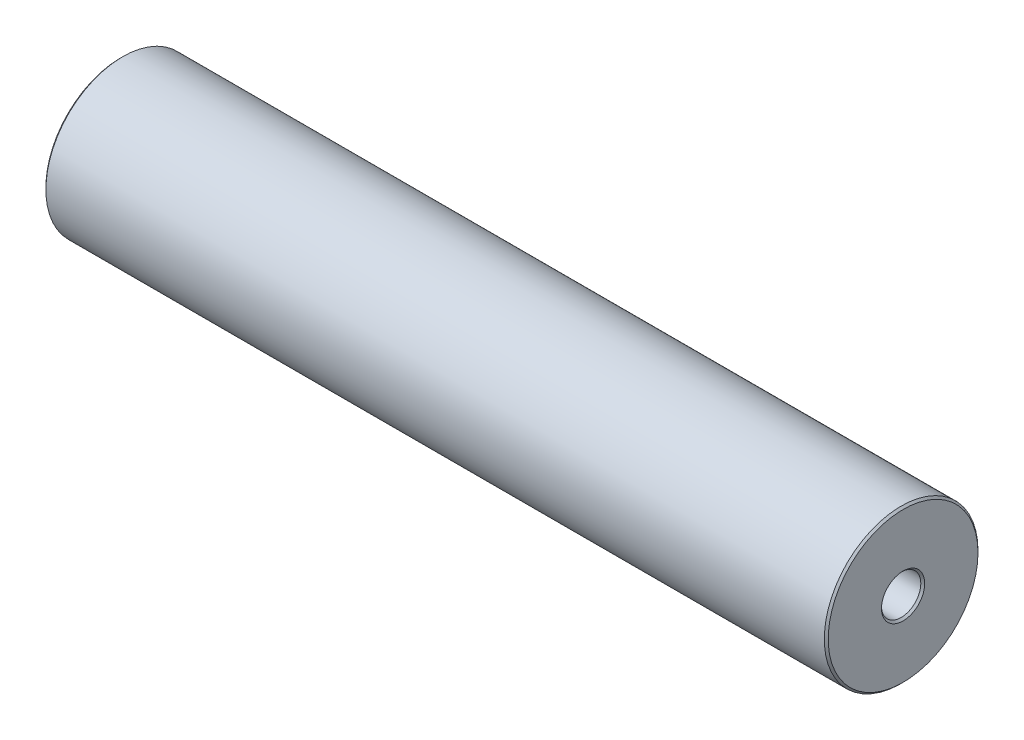
from build123d import *

# Parameters (mm, degrees)
SKETCH2_R                             = 9.980949939
BOSS_EXTRUDE1_DEPTH                   = 50.8
F_1_4_20_TAPPED_HOLE1_D               = 5.1054
F_1_4_20_TAPPED_HOLE1_DEPTH           = 16.51
F_1_4_20_TAPPED_HOLE1_TIP             = 1.533816902
F_1_4_20_TAPPED_HOLE1_ON_FACE_2_D     = 5.1054
F_1_4_20_TAPPED_HOLE1_ON_FACE_2_DEPTH = 16.51
F_1_4_20_TAPPED_HOLE1_ON_FACE_2_TIP   = 1.533816902
CHAMFER1_SIZE                         = 0.254


with BuildPart() as part:
    # Sketch2 → Boss-Extrude1 (new, symmetric)
    with BuildSketch(Plane(origin=(0, 0, 0), x_dir=(0, 0, -1), z_dir=(1, 0, 0))):
        Circle(SKETCH2_R)
    extrude(amount=BOSS_EXTRUDE1_DEPTH, both=True)

    # 1/4-20 Tapped Hole1
    with Locations(Plane(origin=(50.8, 0, 0), x_dir=(0, 0, 1), z_dir=(1, 0, 0))):
        with Locations((0, 0)):
            Hole(F_1_4_20_TAPPED_HOLE1_D / 2, depth=F_1_4_20_TAPPED_HOLE1_DEPTH)
            with Locations((0, 0, -(F_1_4_20_TAPPED_HOLE1_DEPTH + F_1_4_20_TAPPED_HOLE1_TIP / 2))):  # 118° drill point
                Cone(0, F_1_4_20_TAPPED_HOLE1_D / 2, F_1_4_20_TAPPED_HOLE1_TIP, mode=Mode.SUBTRACT)

    # 1/4-20 Tapped Hole1 on face 2
    with Locations(Plane(origin=(-50.8, 0, 0), x_dir=(0, 0, -1), z_dir=(-1, 0, 0))):
        with Locations((0, 0)):
            Hole(F_1_4_20_TAPPED_HOLE1_ON_FACE_2_D / 2, depth=F_1_4_20_TAPPED_HOLE1_ON_FACE_2_DEPTH)
            with Locations((0, 0, -(F_1_4_20_TAPPED_HOLE1_ON_FACE_2_DEPTH + F_1_4_20_TAPPED_HOLE1_ON_FACE_2_TIP / 2))):  # 118° drill point
                Cone(0, F_1_4_20_TAPPED_HOLE1_ON_FACE_2_D / 2, F_1_4_20_TAPPED_HOLE1_ON_FACE_2_TIP, mode=Mode.SUBTRACT)

    # Chamfer1
    chamfer1_edges = [part.edges().sort_by_distance(p)[0] for p in [
        (50.8, 0, 9.980949939),
        (50.8, 0, 2.5527),
        (-50.8, 0, 9.980949939),
        (-50.8, 0, -2.5527),
    ]]
    chamfer(chamfer1_edges, length=CHAMFER1_SIZE)


solid = part.part
